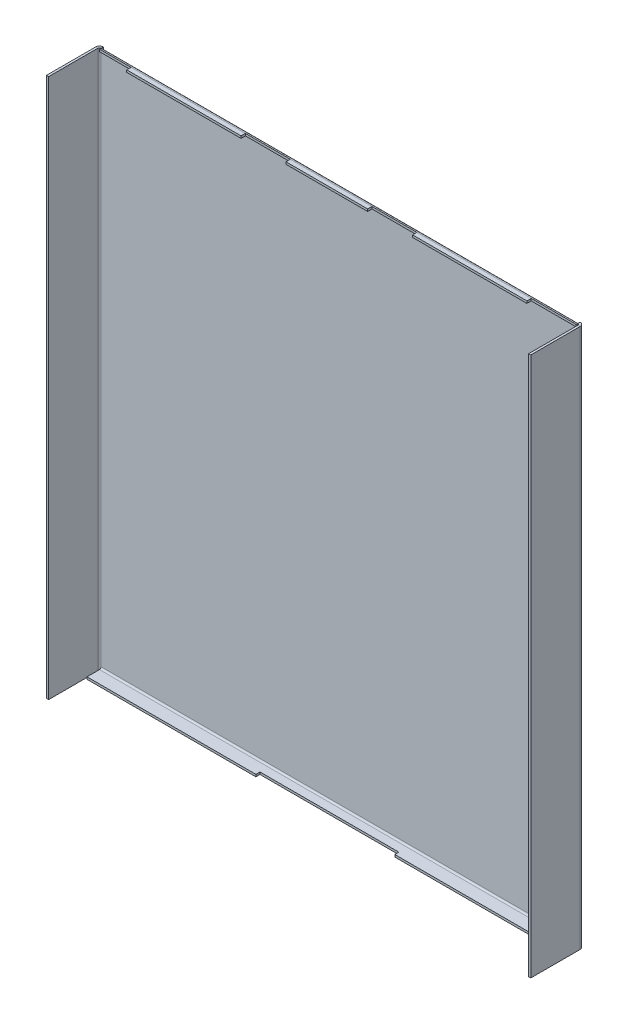
from build123d import *

# Parameters (mm, degrees)
SKETCH1_W                      = 593
SKETCH1_H                      = 660.6
BASE_FLANGE1_DEPTH             = 2.7
EDGE_FLANGE1_STRIP_W           = 14.8
EDGE_FLANGE1_STRIP_H           = 2.7
EDGE_FLANGE1_STRIP_CUT_DEPTH   = 660.6
EDGE_FLANGE1_STRIP_2_W         = 14.8
EDGE_FLANGE1_STRIP_2_H         = 2.7
EDGE_FLANGE1_STRIP_CUT_2_DEPTH = 660.6
EDGE_FLANGE1_DEPTH             = 660.6
EDGE_FLANGE1_BEND_DEPTH        = 660.6
EDGE_FLANGE2_STRIP_W           = 14.8
EDGE_FLANGE2_STRIP_H           = 2.7
EDGE_FLANGE2_STRIP_CUT_DEPTH   = 583.6
EDGE_FLANGE2_DEPTH             = 583.6
CUT_EXTRUDE2_REACH             = 891.9
SKETCH15_W                     = 38.6
SKETCH15_H                     = 5.3
SKETCH15_W_2                   = 55
EDGE_FLANGE3_STRIP_W           = 14.8
EDGE_FLANGE3_STRIP_H           = 2.7
EDGE_FLANGE3_STRIP_CUT_DEPTH   = 583.6
EDGE_FLANGE3_DEPTH             = 583.6
CUT_EXTRUDE3_REACH             = 891.9
SKETCH23_W                     = 170
SKETCH23_H                     = 5


# Sheet-metal steps are written as plain solids
with BuildPart() as part:
    # Sketch1 → Base-Flange1 (new body)
    with BuildSketch(Plane.XY):
        with Locations((296.5, 330.3)):
            Rectangle(SKETCH1_W, SKETCH1_H)
    extrude(amount=-BASE_FLANGE1_DEPTH)

    # Edge-Flange1 strip (across the edge) → Edge-Flange1 strip cut (cut)
    with BuildSketch(Plane.XZ.offset(-660.6)):
        with Locations((-2.7, -1.35)):
            Rectangle(EDGE_FLANGE1_STRIP_W, EDGE_FLANGE1_STRIP_H)
    extrude(amount=EDGE_FLANGE1_STRIP_CUT_DEPTH, mode=Mode.SUBTRACT)

    # Edge-Flange1 strip 2 (across the edge) → Edge-Flange1 strip cut 2 (cut)
    with BuildSketch(Plane(origin=(593, 0, 0), x_dir=(-1, 0, 0), z_dir=(0, 1, 0))):
        with Locations((-2.7, -1.35)):
            Rectangle(EDGE_FLANGE1_STRIP_2_W, EDGE_FLANGE1_STRIP_2_H)
    extrude(amount=EDGE_FLANGE1_STRIP_CUT_2_DEPTH, mode=Mode.SUBTRACT)

    # Edge-Flange1 section (across the edge) → Edge-Flange1 (add)
    with BuildSketch(Plane.XZ.offset(-660.6)):
        with BuildLine():
            Line((0, 2), (0, 62.3))
            Line((0, 62.3), (2.7, 62.3))
            Line((2.7, 62.3), (2.7, 2))
            ThreePointArc((2.7, 2), (3.285786438, 0.585786438), (4.7, 0))
            Line((4.7, 0), (4.7, -2.7))
            ThreePointArc((4.7, -2.7), (1.376598128, -1.323401872), (0, 2))
        make_face()
    extrude(amount=EDGE_FLANGE1_DEPTH)

    # Edge-Flange1 section 2 (across the edge) → Edge-Flange1 bend (add)
    with BuildSketch(Plane(origin=(593, 0, 0), x_dir=(-1, 0, 0), z_dir=(0, 1, 0))):
        with BuildLine():
            Line((0, 2), (0, 62.3))
            Line((0, 62.3), (2.7, 62.3))
            Line((2.7, 62.3), (2.7, 2))
            ThreePointArc((2.7, 2), (3.285786438, 0.585786438), (4.7, 0))
            Line((4.7, 0), (4.7, -2.7))
            ThreePointArc((4.7, -2.7), (1.376598128, -1.323401872), (0, 2))
        make_face()
    extrude(amount=EDGE_FLANGE1_BEND_DEPTH)

    # Edge-Flange2 strip (across the edge) → Edge-Flange2 strip cut (cut)
    with BuildSketch(Plane(origin=(588.3, 660.6, 0), x_dir=(0, -1, 0), z_dir=(-1, 0, 0))):
        with Locations((-2.7, -1.35)):
            Rectangle(EDGE_FLANGE2_STRIP_W, EDGE_FLANGE2_STRIP_H)
    extrude(amount=EDGE_FLANGE2_STRIP_CUT_DEPTH, mode=Mode.SUBTRACT)

    # Edge-Flange2 section (across the edge) → Edge-Flange2 (add)
    with BuildSketch(Plane(origin=(588.3, 660.6, 0), x_dir=(0, -1, 0), z_dir=(-1, 0, 0))):
        with BuildLine():
            Line((0, 2), (0, 7.3))
            Line((0, 7.3), (2.7, 7.3))
            Line((2.7, 7.3), (2.7, 2))
            ThreePointArc((2.7, 2), (3.285786438, 0.585786438), (4.7, 0))
            Line((4.7, 0), (4.7, -2.7))
            ThreePointArc((4.7, -2.7), (1.376598128, -1.323401872), (0, 2))
        make_face()
    extrude(amount=EDGE_FLANGE2_DEPTH)

    # Sketch15 → Cut-Extrude2 (cut, up to next)
    with BuildSketch(Plane(origin=(0, 660.6, 0), x_dir=(1, 0, 0), z_dir=(0, 1, 0)), mode=Mode.PRIVATE) as cut_extrude2_sk1:
        with Locations((24, -4.65)):
            Rectangle(SKETCH15_W, SKETCH15_H)
    cut_extrude2_tool1 = extrude(cut_extrude2_sk1.sketch, amount=-CUT_EXTRUDE2_REACH, mode=Mode.PRIVATE) & part.part
    # Sketch15 → Cut-Extrude2 (cut, up to next)
    with BuildSketch(Plane(origin=(0, 660.6, 0), x_dir=(1, 0, 0), z_dir=(0, 1, 0)), mode=Mode.PRIVATE) as cut_extrude2_sk2:
        with Locations((210.8, -4.65)):
            Rectangle(SKETCH15_W_2, SKETCH15_H)
    cut_extrude2_tool2 = extrude(cut_extrude2_sk2.sketch, amount=-CUT_EXTRUDE2_REACH, mode=Mode.PRIVATE) & part.part
    # Sketch15 → Cut-Extrude2 (cut, up to next)
    with BuildSketch(Plane(origin=(0, 660.6, 0), x_dir=(1, 0, 0), z_dir=(0, 1, 0)), mode=Mode.PRIVATE) as cut_extrude2_sk3:
        with Locations((365.8, -4.65)):
            Rectangle(SKETCH15_W_2, SKETCH15_H)
    cut_extrude2_tool3 = extrude(cut_extrude2_sk3.sketch, amount=-CUT_EXTRUDE2_REACH, mode=Mode.PRIVATE) & part.part
    # Sketch15 → Cut-Extrude2 (cut, up to next)
    with BuildSketch(Plane(origin=(0, 660.6, 0), x_dir=(1, 0, 0), z_dir=(0, 1, 0)), mode=Mode.PRIVATE) as cut_extrude2_sk4:
        with Locations((560.8, -4.65)):
            Rectangle(SKETCH15_W_2, SKETCH15_H)
    cut_extrude2_tool4 = extrude(cut_extrude2_sk4.sketch, amount=-CUT_EXTRUDE2_REACH, mode=Mode.PRIVATE) & part.part
    add(cut_extrude2_tool1.solids().sort_by_distance((24, 660.6, 4.65))[0], mode=Mode.SUBTRACT)
    add(cut_extrude2_tool2.solids().sort_by_distance((210.8, 660.6, 4.65))[0], mode=Mode.SUBTRACT)
    add(cut_extrude2_tool3.solids().sort_by_distance((365.8, 660.6, 4.65))[0], mode=Mode.SUBTRACT)
    add(cut_extrude2_tool4.solids().sort_by_distance((560.8, 660.6, 4.65))[0], mode=Mode.SUBTRACT)

    # Edge-Flange3 strip (across the edge) → Edge-Flange3 strip cut (cut)
    with BuildSketch(Plane.YZ.offset(4.7)):
        with Locations((-2.7, -1.35)):
            Rectangle(EDGE_FLANGE3_STRIP_W, EDGE_FLANGE3_STRIP_H)
    extrude(amount=EDGE_FLANGE3_STRIP_CUT_DEPTH, mode=Mode.SUBTRACT)

    # Edge-Flange3 section (across the edge) → Edge-Flange3 (add)
    with BuildSketch(Plane.YZ.offset(4.7)):
        with BuildLine():
            Line((0, 2), (0, 17.3))
            Line((0, 17.3), (2.7, 17.3))
            Line((2.7, 17.3), (2.7, 2))
            ThreePointArc((2.7, 2), (3.285786438, 0.585786438), (4.7, 0))
            Line((4.7, 0), (4.7, -2.7))
            ThreePointArc((4.7, -2.7), (1.376598128, -1.323401872), (0, 2))
        make_face()
    extrude(amount=EDGE_FLANGE3_DEPTH)

    # Sketch23 → Cut-Extrude3 (cut, up to next)
    with BuildSketch(Plane.XZ, mode=Mode.PRIVATE) as cut_extrude3_sk1:
        with Locations((296.5, 14.8)):
            Rectangle(SKETCH23_W, SKETCH23_H)
    cut_extrude3_tool1 = extrude(cut_extrude3_sk1.sketch, amount=-CUT_EXTRUDE3_REACH, mode=Mode.PRIVATE) & part.part
    add(cut_extrude3_tool1.solids().sort_by_distance((296.5, 0, 14.8))[0], mode=Mode.SUBTRACT)


solid = part.part
